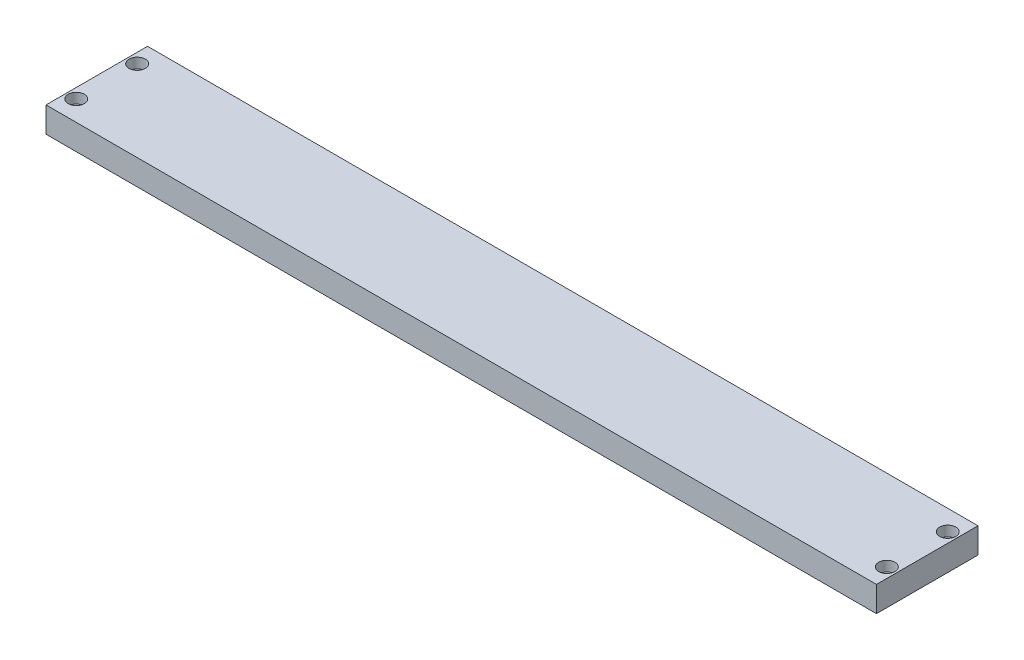
from build123d import *

# Parameters (mm, degrees)
SKETCH1_W           = 163.57
SKETCH1_H           = 20
SKETCH1_R           = 1
BOSS_EXTRUDE1_DEPTH = 5
SKETCH2_R           = 1.6
CUT_EXTRUDE1_DEPTH  = 2


with BuildPart() as part:
    # Sketch1 → Boss-Extrude1 (new body)
    with BuildSketch(Plane(origin=(0, 0, 0), x_dir=(1, 0, 0), z_dir=(0, 1, 0))):
        Rectangle(SKETCH1_W, SKETCH1_H)
        with Locations((-79.825, 6)):
            Circle(SKETCH1_R, mode=Mode.SUBTRACT)
        with Locations((-79.825, -6)):
            Circle(SKETCH1_R, mode=Mode.SUBTRACT)
        with Locations((79.825, 6)):
            Circle(SKETCH1_R, mode=Mode.SUBTRACT)
        with Locations((79.825, -6)):
            Circle(SKETCH1_R, mode=Mode.SUBTRACT)
    extrude(amount=BOSS_EXTRUDE1_DEPTH)

    # Sketch2 → Cut-Extrude1 (cut)
    with BuildSketch(Plane(origin=(0, 5, 0), x_dir=(1, 0, 0), z_dir=(0, 1, 0))):
        with Locations((-79.825, 6)):
            Circle(SKETCH2_R)
        with Locations((-79.825, -6)):
            Circle(SKETCH2_R)
        with Locations((79.825, 6)):
            Circle(SKETCH2_R)
        with Locations((79.825, -6)):
            Circle(SKETCH2_R)
    extrude(amount=-CUT_EXTRUDE1_DEPTH, mode=Mode.SUBTRACT)


solid = part.part
